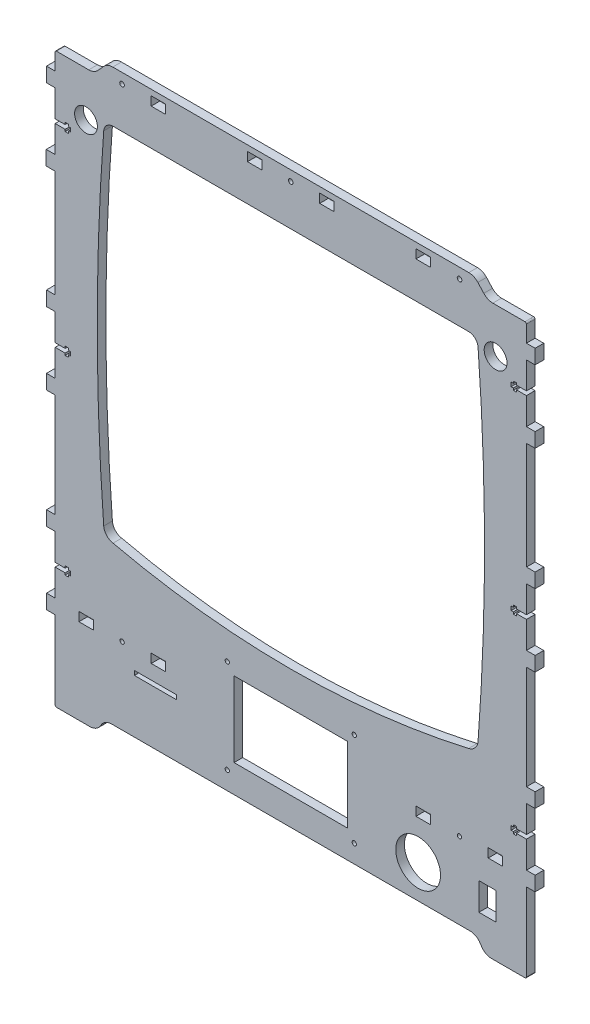
from build123d import *

# Parameters (mm, degrees)
SKETCH_1_R      = 1.5
SKETCH_1_R_2    = 15.5
SKETCH_1_R_3    = 1.6
SKETCH_1_R_4    = 7.9
SKETCH_1_W      = 10
SKETCH_1_H      = 6.199787221
SKETCH_1_H_2    = 6.19978722
SKETCH_1_W_2    = 78.6
SKETCH_1_H_3    = 52
SKETCH_1_W_3    = 12
SKETCH_1_H_4    = 19
SKETCH_1_W_4    = 29
SKETCH_1_H_5    = 3
EXTRUDE_2_DEPTH = 6


with BuildPart() as part:
    # Эскиз1 → Бобышка-Вытянуть2 (new body)
    with BuildSketch(Plane.XY):
        with BuildLine():
            Line((-162.349245127, -146.988296843), (-168.349245127, -146.988296843))
            Line((-168.349245127, -146.988296843), (-168.349245127, -136.988296843))
            Line((-168.349245127, -136.988296843), (-162.349245127, -136.988296843))
            Line((-162.349245127, -136.988296843), (-162.349245127, -118.378296843))
            Line((-162.349245127, -118.378296843), (-155.437302827, -118.378296843))
            Line((-155.437302827, -118.378296843), (-155.437302827, -119.778400867))
            Line((-155.437302827, -119.778400867), (-153.236480245, -119.778400867))
            Line((-153.236480245, -119.778400867), (-153.237302317, -118.378519903))
            Line((-153.237302317, -118.378519903), (-151.737303175, -118.377639037))
            Line((-151.737303175, -118.377639037), (-151.738946321, -115.579576507))
            Line((-151.738946321, -115.579576507), (-153.238946062, -115.580457374))
            Line((-153.238946062, -115.580457374), (-153.239768743, -114.179540119))
            Line((-153.239768743, -114.179540119), (-155.439769153, -114.179486778))
            Line((-155.439769153, -114.179486778), (-155.439803097, -115.579486778))
            Line((-155.439803097, -115.579486778), (-162.349245127, -115.578296843))
            Line((-162.349245127, -115.578296843), (-162.349245127, -96.998296843))
            Line((-162.349245127, -96.998296843), (-168.349245127, -96.998296843))
            Line((-168.349245127, -96.998296843), (-168.349245127, -86.998296843))
            Line((-168.349245127, -86.998296843), (-162.349245127, -86.998296843))
            Line((-162.349245127, -86.998296843), (-162.349245127, -15.268296843))
            Line((-162.349245127, -15.268296843), (-168.349245127, -15.268296843))
            Line((-168.349245127, -15.268296843), (-168.349245127, -5.268296843))
            Line((-168.349245127, -5.268296843), (-162.349245127, -5.268296843))
            Line((-162.349245127, -5.268296843), (-162.349245127, 13.331703157))
            Line((-162.349245127, 13.331703157), (-155.437302827, 13.331703157))
            Line((-155.437302827, 13.331703157), (-155.437302827, 11.931599133))
            Line((-155.437302827, 11.931599133), (-153.236480245, 11.931599133))
            Line((-153.236480245, 11.931599133), (-153.23728574, 13.303251748))
            Line((-153.23728574, 13.303251748), (-151.737302575, 13.304132604))
            Line((-151.737302575, 13.304132604), (-151.738946321, 16.130423493))
            Line((-151.738946321, 16.130423493), (-153.238946062, 16.129542626))
            Line((-153.238946062, 16.129542626), (-153.239768743, 17.530459881))
            Line((-153.239768743, 17.530459881), (-155.439769153, 17.530513222))
            Line((-155.439769153, 17.530513222), (-155.439803097, 16.130513222))
            Line((-155.439803097, 16.130513222), (-162.349245127, 16.131703157))
            Line((-162.349245127, 16.131703157), (-162.349245127, 34.731703157))
            Line((-162.349245127, 34.731703157), (-168.349245127, 34.731703157))
            Line((-168.349245127, 34.731703157), (-168.349245127, 44.731703157))
            Line((-168.349245127, 44.731703157), (-162.349245127, 44.731703157))
            Line((-162.349245127, 44.731703157), (-162.349245127, 118.891703157))
            Line((-162.349245127, 118.891703157), (-168.525304034, 118.891703157))
            Line((-168.525304034, 118.891703157), (-168.525304034, 128.891703157))
            Line((-168.525304034, 128.891703157), (-162.349245127, 128.891703157))
            Line((-162.349245127, 128.891703157), (-162.349245127, 147.491703157))
            Line((-162.349245127, 147.491703157), (-155.437302827, 147.491703157))
            Line((-155.437302827, 147.491703157), (-155.437302827, 146.091599133))
            Line((-155.437302827, 146.091599133), (-153.236480245, 146.091599133))
            Line((-153.236480245, 146.091599133), (-153.237302317, 147.491480097))
            Line((-153.237302317, 147.491480097), (-151.737303175, 147.492360963))
            Line((-151.737303175, 147.492360963), (-151.738946321, 150.290423493))
            Line((-151.738946321, 150.290423493), (-153.238946062, 150.289542626))
            Line((-153.238946062, 150.289542626), (-153.239768743, 151.690459881))
            Line((-153.239768743, 151.690459881), (-155.439769153, 151.690513222))
            Line((-155.439769153, 151.690513222), (-155.439803097, 150.290513222))
            Line((-155.439803097, 150.290513222), (-162.349245127, 150.291703157))
            Line((-162.349245127, 150.291703157), (-162.349245127, 168.891703157))
            Line((-162.349245127, 168.891703157), (-168.349245127, 168.891703157))
            Line((-168.349245127, 168.891703157), (-168.349245127, 178.891703157))
            Line((-168.349245127, 178.891703157), (-162.349245127, 178.891703157))
            Line((-162.349245127, 178.891703157), (-162.349245127, 190.291703157))
            ThreePointArc((-162.349245127, 190.291703157), (-162.144381362, 190.962346945), (-161.525304034, 191.291703157))
            Line((-161.525304034, 191.291703157), (-139.092392644, 191.291703157))
            ThreePointArc((-139.092392644, 191.291703157), (-135.666701236, 192.012587631), (-132.82207518, 194.052964716))
            Line((-132.82207518, 194.052964716), (-128.724185584, 198.530441598))
            ThreePointArc((-128.724185584, 198.530441598), (-125.879559527, 200.570818684), (-122.453868119, 201.291703157))
            Line((-122.453868119, 201.291703157), (123.955377865, 201.291703157))
            ThreePointArc((123.955377865, 201.291703157), (127.381069274, 200.570818684), (130.22569533, 198.530441598))
            Line((130.22569533, 198.530441598), (134.323584926, 194.052964716))
            ThreePointArc((134.323584926, 194.052964716), (137.168210982, 192.012587631), (140.59390239, 191.291703157))
            Line((140.59390239, 191.291703157), (162.850754873, 191.291703157))
            ThreePointArc((162.850754873, 191.291703157), (163.557861654, 190.998809938), (163.850754873, 190.291703157))
            Line((163.850754873, 190.291703157), (163.850754873, 178.891703157))
            Line((163.850754873, 178.891703157), (169.850754873, 178.891703157))
            Line((169.850754873, 178.891703157), (169.850754873, 168.891703157))
            Line((169.850754873, 168.891703157), (163.850754873, 168.891703157))
            Line((163.850754873, 168.891703157), (163.850754873, 150.291703157))
            Line((163.850754873, 150.291703157), (156.938753666, 150.291703157))
            Line((156.938753666, 150.291703157), (156.938753666, 151.691807182))
            Line((156.938753666, 151.691807182), (154.737931084, 151.691807182))
            Line((154.737931084, 151.691807182), (154.738753156, 150.291926217))
            Line((154.738753156, 150.291926217), (153.238753414, 150.291045351))
            Line((153.238753414, 150.291045351), (153.24039716, 147.491962545))
            Line((153.24039716, 147.491962545), (154.740396901, 147.492843411))
            Line((154.740396901, 147.492843411), (154.741219582, 146.091926156))
            Line((154.741219582, 146.091926156), (156.941220143, 146.091872816))
            Line((156.941220143, 146.091872816), (156.941254112, 147.492893051))
            Line((156.941254112, 147.492893051), (163.850755049, 147.491703116))
            Line((163.850755049, 147.491703116), (163.850755049, 128.891703116))
            Line((163.850755049, 128.891703116), (169.850754873, 128.891703116))
            Line((169.850754873, 128.891703116), (169.850754873, 118.891703116))
            Line((169.850754873, 118.891703116), (163.850754873, 118.891703116))
            Line((163.850754873, 118.891703116), (163.850754873, 44.731703116))
            Line((163.850754873, 44.731703116), (169.850754873, 44.731703116))
            Line((169.850754873, 44.731703116), (169.850754873, 34.731703116))
            Line((169.850754873, 34.731703116), (163.850754873, 34.731703116))
            Line((163.850754873, 34.731703116), (163.850754873, 16.131703116))
            Line((163.850754873, 16.131703116), (156.938753666, 16.131703116))
            Line((156.938753666, 16.131703116), (156.938753666, 17.504737934))
            Line((156.938753666, 17.504737934), (154.737931084, 17.504737934))
            Line((154.737931084, 17.504737934), (154.738753156, 16.131926176))
            Line((154.738753156, 16.131926176), (153.238753414, 16.131045309))
            Line((153.238753414, 16.131045309), (153.24039716, 13.331962503))
            Line((153.24039716, 13.331962503), (154.740396901, 13.332843369))
            Line((154.740396901, 13.332843369), (154.741219582, 11.931926114))
            Line((154.741219582, 11.931926114), (156.941219968, 11.931872774))
            Line((156.941219968, 11.931872774), (156.941253936, 13.332893051))
            Line((156.941253936, 13.332893051), (163.850754873, 13.331703116))
            Line((163.850754873, 13.331703116), (163.850754873, -5.268296884))
            Line((163.850754873, -5.268296884), (169.850754873, -5.268296884))
            Line((169.850754873, -5.268296884), (169.850754873, -15.268296884))
            Line((169.850754873, -15.268296884), (163.850754873, -15.268296884))
            Line((163.850754873, -15.268296884), (163.850754873, -86.998296884))
            Line((163.850754873, -86.998296884), (169.850754873, -86.998296884))
            Line((169.850754873, -86.998296884), (169.850754873, -96.998296884))
            Line((169.850754873, -96.998296884), (163.938754873, -96.998296884))
            Line((163.938754873, -96.998296884), (163.938754873, -115.578296884))
            Line((163.938754873, -115.578296884), (156.938753666, -115.578296884))
            Line((156.938753666, -115.578296884), (156.938753666, -114.17819286))
            Line((156.938753666, -114.17819286), (154.737931084, -114.17819286))
            Line((154.737931084, -114.17819286), (154.738753156, -115.578073824))
            Line((154.738753156, -115.578073824), (153.238753414, -115.578954691))
            Line((153.238753414, -115.578954691), (153.24039716, -118.378037497))
            Line((153.24039716, -118.378037497), (154.740396901, -118.377156631))
            Line((154.740396901, -118.377156631), (154.741219582, -119.778073886))
            Line((154.741219582, -119.778073886), (156.941327387, -119.778127228))
            Line((156.941327387, -119.778127228), (156.941361355, -118.377106949))
            Line((156.941361355, -118.377106949), (163.850862292, -118.378296884))
            Line((163.850862292, -118.378296884), (163.850862292, -136.988296884))
            Line((163.850862292, -136.988296884), (169.850754873, -136.988296884))
            Line((169.850754873, -136.988296884), (169.850754873, -146.988296884))
            Line((169.850754873, -146.988296884), (163.850754873, -146.988296884))
            Line((163.850754873, -146.988296884), (163.850754873, -201.030481009))
            ThreePointArc((163.850754873, -201.030481009), (163.505335147, -201.739470976), (162.762754873, -202.005094953))
            Line((162.762754873, -202.005094953), (139.726369967, -202.005094953))
            ThreePointArc((139.726369967, -202.005094953), (136.178541077, -201.200406287), (133.302992201, -198.971991525))
            Line((133.302992201, -198.971991525), (131.246288055, -195.95233843))
            ThreePointArc((131.246288055, -195.95233843), (128.327165513, -193.712416922), (124.734910288, -192.916033112))
            Line((124.734910288, -192.916033112), (-123.233400542, -192.916033112))
            ThreePointArc((-123.233400542, -192.916033112), (-126.825655767, -193.712416922), (-129.744778309, -195.95233843))
            Line((-129.744778309, -195.95233843), (-131.801482455, -198.971991525))
            ThreePointArc((-131.801482455, -198.971991525), (-134.720604996, -201.211913033), (-138.312860221, -202.008296843))
            Line((-138.312860221, -202.008296843), (-161.437304034, -202.008296843))
            ThreePointArc((-161.437304034, -202.008296843), (-162.093143033, -201.704284858), (-162.349245127, -201.028296843))
            Line((-162.349245127, -201.028296843), (-162.349245127, -146.988296843))
        make_face()
        with Locations((44.710754873, -115.425672952)):
            Circle(SKETCH_1_R, mode=Mode.SUBTRACT)
        with Locations((44.710754873, -180.425672952)):
            Circle(SKETCH_1_R, mode=Mode.SUBTRACT)
        with Locations((-43.209245127, -180.425672952)):
            Circle(SKETCH_1_R, mode=Mode.SUBTRACT)
        with Locations((-43.209245127, -115.425672952)):
            Circle(SKETCH_1_R, mode=Mode.SUBTRACT)
        with Locations((88.894233967, -169.827856004)):
            Circle(SKETCH_1_R_2, mode=Mode.SUBTRACT)
        with Locations((0.750754873, 194.241703157)):
            Circle(SKETCH_1_R_3, mode=Mode.SUBTRACT)
        with Locations((-116.049245127, 194.241703157)):
            Circle(SKETCH_1_R_3, mode=Mode.SUBTRACT)
        with Locations((117.550754873, 194.241703157)):
            Circle(SKETCH_1_R_3, mode=Mode.SUBTRACT)
        with Locations((-140.999245127, 160.291703157)):
            Circle(SKETCH_1_R_4, mode=Mode.SUBTRACT)
        with Locations((142.500754873, 160.291703157)):
            Circle(SKETCH_1_R_4, mode=Mode.SUBTRACT)
        with Locations((-115.989245127, -139.858846732)):
            Circle(SKETCH_1_R, mode=Mode.SUBTRACT)
        with Locations((117.490754873, -139.847693345)):
            Circle(SKETCH_1_R, mode=Mode.SUBTRACT)
        with Locations((-90.889245127, 194.249228604)):
            Rectangle(SKETCH_1_W, SKETCH_1_H, mode=Mode.SUBTRACT)
        with Locations((92.390754873, 194.249228604)):
            Rectangle(SKETCH_1_W, SKETCH_1_H, mode=Mode.SUBTRACT)
        with Locations((92.370754873, -139.827190453)):
            Rectangle(SKETCH_1_W, SKETCH_1_H_2, mode=Mode.SUBTRACT)
        with Locations((142.390754873, -139.827190453)):
            Rectangle(SKETCH_1_W, SKETCH_1_H_2, mode=Mode.SUBTRACT)
        with Locations((-140.889245127, -139.827190453)):
            Rectangle(SKETCH_1_W, SKETCH_1_H_2, mode=Mode.SUBTRACT)
        with Locations((-90.869245127, -139.827190453)):
            Rectangle(SKETCH_1_W, SKETCH_1_H_2, mode=Mode.SUBTRACT)
        with Locations((-24.239245127, 194.249228604)):
            Rectangle(SKETCH_1_W, SKETCH_1_H, mode=Mode.SUBTRACT)
        with Locations((25.740754873, 194.249228604)):
            Rectangle(SKETCH_1_W, SKETCH_1_H, mode=Mode.SUBTRACT)
        with BuildLine():
            Line((-122.192597833, 165.873018888), (123.830630504, 165.873018888))
            ThreePointArc((123.830630504, 165.873018888), (128.258284938, 164.15368067), (130.365274226, 159.896822223))
            ThreePointArc((130.365274226, 159.896822223), (134.836083817, 41.46068574), (130.331866171, -76.974184913))
            ThreePointArc((130.331866171, -76.974184913), (128.183821596, -81.497473491), (123.855438217, -84.015276578))
            ThreePointArc((123.855438217, -84.015276578), (0.79541861, -98.015276578), (-122.264600996, -84.015276578))
            ThreePointArc((-122.264600996, -84.015276578), (-126.723804725, -81.617901571), (-128.740683608, -76.974184913))
            ThreePointArc((-128.740683608, -76.974184913), (-133.230490231, 41.461567097), (-128.727595553, 159.896822224))
            ThreePointArc((-128.727595553, 159.896822224), (-126.639748548, 164.174875124), (-122.192597833, 165.873018888))
        make_face(mode=Mode.SUBTRACT)
        with Locations((0.750754873, -147.675672952)):
            Rectangle(SKETCH_1_W_2, SKETCH_1_H_3, mode=Mode.SUBTRACT)
        with Locations((136.938754873, -169.176180946)):
            Rectangle(SKETCH_1_W_3, SKETCH_1_H_4, mode=Mode.SUBTRACT)
        with Locations((-93.004246156, -154.427084063)):
            Rectangle(SKETCH_1_W_4, SKETCH_1_H_5, mode=Mode.SUBTRACT)
    extrude(amount=EXTRUDE_2_DEPTH)


solid = part.part
